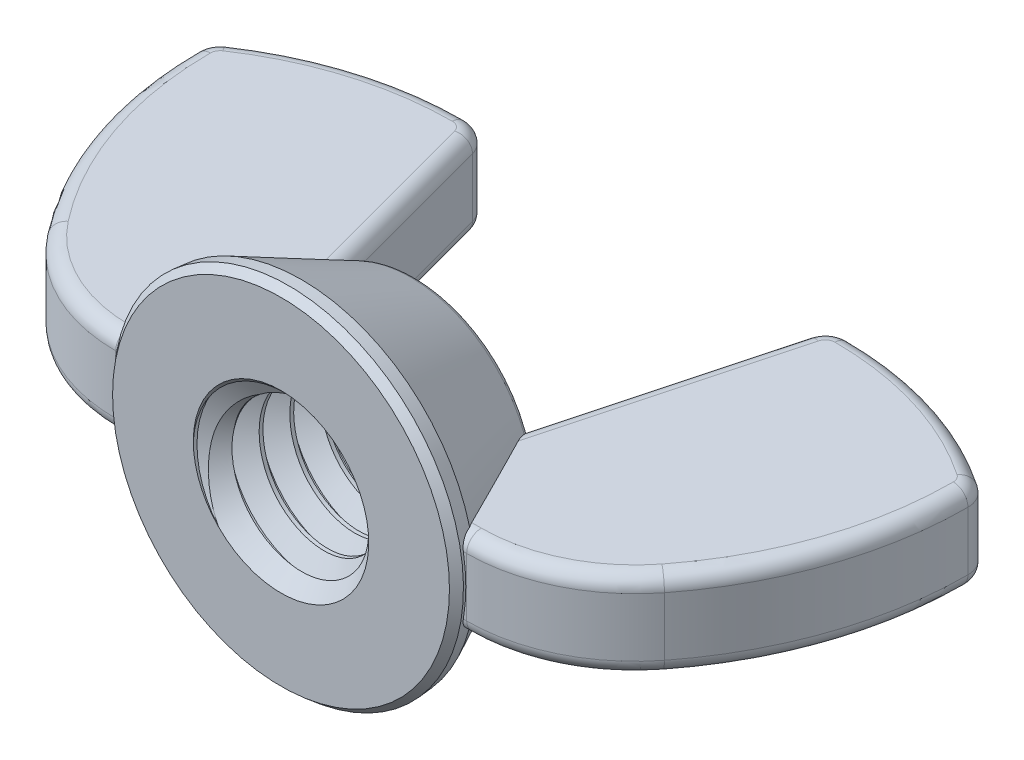
from build123d import *

# Parameters (mm, degrees)
EXTRUDE2_DEPTH     = 1
SKETCH3_R          = 4
EXTRUDE1_DEPTH     = 0.4644
EXTRUDE1_DRAFT     = -5
SKETCH15_R         = 3.959370265
EXTRUDE3_DEPTH     = 2.6316
EXTRUDE3_TAPER     = 25.727057867
FILLET3_R          = 0.254
SKETCH4_R          = 2
CUT_EXTRUDE1_DEPTH = 13.938315192
SWEEP1_PITCH       = 0.7
SKETCH7_R          = 4
CUT_EXTRUDE2_DEPTH = 13.938315223
SKETCH8_R          = 3.959370265
CUT_EXTRUDE3_DEPTH = 12.123579316
SKETCH11_R         = 1.9492
CUT_EXTRUDE5_DEPTH = 12.12357928
CUT_EXTRUDE5_TAPER = 45
CHAMFER1_SIZE      = 0.17415
CHAMFER1_SIZE2     = 0.160751308
FILLET4_R          = 0.333333333


with BuildPart() as part:
    # Sketch13 → Extrude2 (new, symmetric)
    with BuildSketch(Plane(origin=(0, 0, 0), x_dir=(1, 0, 0), z_dir=(0, 1, 0))):
        with BuildLine():
            Line((2.458768934, 0.2322), (4, 0.2322))
            ThreePointArc((4, 0.2322), (5.684775324, 0.621263487), (7.02836148, 1.709663474))
            ThreePointArc((7.02836148, 1.709663474), (8.344696125, 4.135051994), (8.8, 6.856805979))
            ThreePointArc((8.8, 6.856805979), (8.734970885, 7.117623514), (8.555107169, 7.317382408))
            ThreePointArc((8.555107169, 7.317382408), (6.553324856, 8.272183593), (4.359854061, 8.6))
            ThreePointArc((4.359854061, 8.6), (4.021653267, 8.4851963), (3.823228602, 8.188232803))
            Line((3.823228602, 8.188232803), (2.458768934, 3.096))
            Line((2.458768934, 3.096), (2.458768934, 0.2322))
        make_face()
    extrude(amount=EXTRUDE2_DEPTH, both=True)

    # Fillet4
    fillet4_edges = [part.edges().sort_by_distance(p)[0] for p in [
        (5.684775324, 1, -0.621263487),
        (3.229384467, -1, -0.2322),
        (8.344696125, 1, -4.135051994),
        (8.734970885, 1, -7.117623514),
        (6.553324856, 1, -8.272183593),
        (4.021653267, 1, -8.4851963),
        (3.140998768, 1, -5.642116401),
        (3.229384467, 1, -0.2322),
        (3.140998768, -1, -5.642116401),
        (4.021653267, -1, -8.4851963),
        (6.553324856, -1, -8.272183593),
        (8.734970885, -1, -7.117623514),
        (8.344696125, -1, -4.135051994),
        (5.684775324, -1, -0.621263487),
    ]]
    fillet(fillet4_edges, radius=FILLET4_R)


with BuildPart() as body_2:
    # Sketch3 → Extrude1 (with draft: the straight prism first)
    with BuildSketch(Plane.XY):
        Circle(SKETCH3_R)
    extrude(amount=-EXTRUDE1_DEPTH)
    # Extrude1: the draft: its side faces are tilted about the plane it starts from
    extrude1_sides = [body_2.faces().sort_by_distance(p)[0] for p in [
        (-4, 0, -0.2322),
    ]]
    draft(extrude1_sides, Plane.XY, EXTRUDE1_DRAFT)

    # Sketch15 → Extrude3 (add)
    with BuildSketch(Plane(origin=(0, 0, -0.4644), x_dir=(-1, 0, 0), z_dir=(0, 0, -1))):
        Circle(SKETCH15_R)
    extrude(amount=EXTRUDE3_DEPTH, taper=EXTRUDE3_TAPER)

    # Fillet3
    fillet3_edges = [body_2.edges().sort_by_distance(p)[0] for p in [
        (2.691335747, 0, -3.096),
    ]]
    fillet(fillet3_edges, radius=FILLET3_R)

    # Sketch4 → Cut-Extrude1 (cut, through all)
    with BuildSketch(Plane.XY):
        Circle(SKETCH4_R)
    extrude(amount=-CUT_EXTRUDE1_DEPTH, mode=Mode.SUBTRACT)

    # Sweep1: the profile of Sketch6 profile screwed along a right-hand helix of 7.28 turns, 6 arcs to a turn; built about Z, then put on its axis
    sweep1_z = Axis((0, 0, 0), (0, 0, 1))
    sweep1_corners = [(2.0003, 0, -0.612673205), (1.545336663, 0, -0.35), (1.545336663, 0, -0.2625), (2.0003, 0, 0.000173205)]
    with BuildLine(mode=Mode.PRIVATE) as sweep1_profile:
        Line(sweep1_corners[0], sweep1_corners[1])
        Line(sweep1_corners[1], sweep1_corners[2])
        Line(sweep1_corners[2], sweep1_corners[3])
        Line(sweep1_corners[3], sweep1_corners[0])
    sweep1_cap = Face(sweep1_profile.wire())
    sweep1_turn_angles = [0, 30, 60, 90, 120, 150, 180, 210, 240, 270, 300, 330, 360]
    sweep1_turn_weights = [1, 0.8660254037844387, 1, 0.8660254037844387, 1, 0.8660254037844387, 1, 0.8660254037844387, 1, 0.8660254037844387, 1, 0.8660254037844387, 1]
    sweep1_turn_rails = [Edge.make_bspline([Vector(p[0], p[1], 0).rotate(sweep1_z, sweep1_turn_angles[k]) / sweep1_turn_weights[k] + Vector(0, 0, p[2] + SWEEP1_PITCH * sweep1_turn_angles[k] / 360) for k in range(13)], [0, 0, 0, 1, 1, 2, 2, 3, 3, 4, 4, 5, 5, 6, 6, 6], 2, sweep1_turn_weights) for p in sweep1_corners]
    sweep1_turn_sides = [Face.make_surface_from_curves(sweep1_turn_rails[p[0]], sweep1_turn_rails[p[1]]) for p in [(0, 1), (1, 2), (2, 3), (3, 0)]]
    sweep1_last_angles = [2520, 2550, 2580, 2600.4, 2620.8]
    sweep1_last_weights = [1, 0.8660254037844387, 1, 0.9372819894918771, 1]
    sweep1_last_rails = [Edge.make_bspline([Vector(p[0], p[1], 0).rotate(sweep1_z, sweep1_last_angles[k]) / sweep1_last_weights[k] + Vector(0, 0, p[2] + SWEEP1_PITCH * sweep1_last_angles[k] / 360) for k in range(5)], [0, 0, 0, 1, 1, 2, 2, 2], 2, sweep1_last_weights) for p in sweep1_corners]
    sweep1_last_sides = [Face.make_surface_from_curves(sweep1_last_rails[p[0]], sweep1_last_rails[p[1]]) for p in [(0, 1), (1, 2), (2, 3), (3, 0)]]
    sweep1 = Plane(origin=(0, 0, 0), x_dir=(-1, 0, 0), z_dir=(0, 0, -1)) * Solid(Shell([*[p.moved(Location((0, 0, SWEEP1_PITCH * i))) for i in range(7) for p in sweep1_turn_sides], *sweep1_last_sides, sweep1_cap, sweep1_cap.rotate(sweep1_z, 2620.8).moved(Location((0, 0, SWEEP1_PITCH * 2620.8 / 360)))]))
    add(sweep1)

    # Sketch7 → Cut-Extrude2 (cut, through all)
    with BuildSketch(Plane.XY):
        Circle(SKETCH7_R)
    extrude(amount=CUT_EXTRUDE2_DEPTH, mode=Mode.SUBTRACT)

    # Sketch8 → Cut-Extrude3 (cut, through all)
    with BuildSketch(Plane.XY.offset(-3.096)):
        Circle(SKETCH8_R)
    extrude(amount=-CUT_EXTRUDE3_DEPTH, mode=Mode.SUBTRACT)

    # Cut-Extrude4 cone 1 section (through the dimple's axis) → Cut-Extrude4 (revolve, cut)
    with BuildSketch(Plane(origin=(0, 0, 0), x_dir=(0, -1, 0), z_dir=(1, 0, 0))):
        Polygon((0, 0), (2, 0), (0, 2), align=None)
    revolve(axis=Axis((0, 0, 0), (0, 0, -1)), mode=Mode.SUBTRACT)

    # Sketch11 → Cut-Extrude5 (cut, through all)
    with BuildSketch(Plane.XY.offset(-3.096)):
        Circle(SKETCH11_R)
    extrude(amount=CUT_EXTRUDE5_DEPTH, taper=CUT_EXTRUDE5_TAPER, mode=Mode.SUBTRACT)

    # Chamfer1
    chamfer1_edges = [body_2.edges().sort_by_distance(p)[0] for p in [
        (-4, 0, 0),
    ]]
    chamfer1_side = [body_2.faces().sort_by_distance(p)[0] for p in [
        (-3.979685132, 0, -0.2322),
    ]]
    chamfer(chamfer1_edges, length=CHAMFER1_SIZE, length2=CHAMFER1_SIZE2, reference=chamfer1_side[0])


with BuildPart() as body_3:
    # Mirror6: mirrored copy
    add(part.part.mirror(Plane(origin=(0, 0, 0), x_dir=(0, 0, 1), z_dir=(1, 0, 0))))

    # Combine2: union part, body 2
    add(part.part)
    add(body_2.part)


solid = body_3.part
